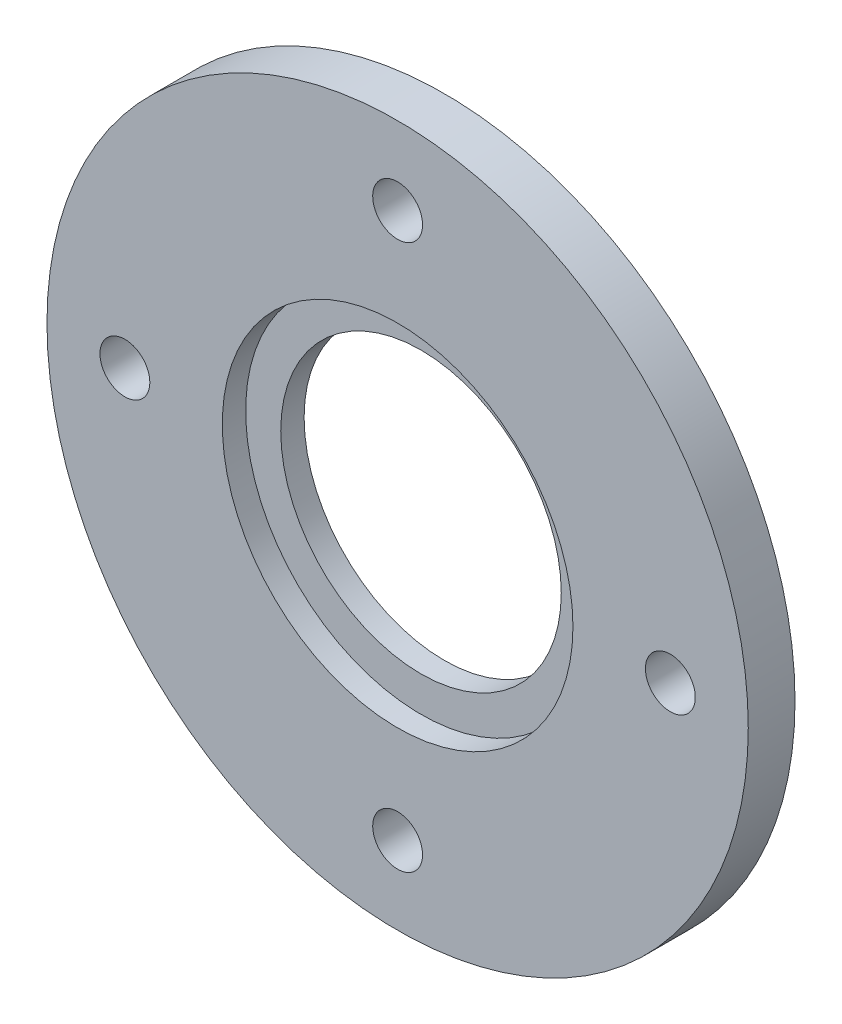
from build123d import *

# Parameters (mm, degrees)
SKETCH_1_R               = 22.5
SKETCH_1_R_2             = 9
EXTRUDE_1_DEPTH          = 3
SKETCH_2_R               = 1.6
CUT_EXTRUDE_1_DEPTH      = 32.960913629
PATTERN_CIRCULAR_2_COUNT = 4
CUT_EXTRUDE_START        = -1.5
SKETCH_3_R               = 11.25
SKETCH_3_R_2             = 9
CUT_EXTRUDE_2_DEPTH      = 1.5


with BuildPart() as part:
    # ｽｹｯﾁ1 → ﾎﾞｽ - 押し出し1 (new body)
    with BuildSketch(Plane.XY):
        Circle(SKETCH_1_R)
        Circle(SKETCH_1_R_2, mode=Mode.SUBTRACT)
    extrude(amount=EXTRUDE_1_DEPTH)

    # ｽｹｯﾁ2 → ｶｯﾄ - 押し出し1 (cut, through all)
    with BuildSketch(Plane.XY.offset(3)):
        with Locations((-17.5, 0)):
            Circle(SKETCH_2_R)
    cut_extrude_1 = extrude(amount=-CUT_EXTRUDE_1_DEPTH, mode=Mode.SUBTRACT)

    # 円形ﾊﾟﾀｰﾝ2: ｶｯﾄ - 押し出し1 ×4 about axis
    pattern_circular_2_axis = Axis((0, 0, 3), (0, 0, -1))
    for i in range(1, PATTERN_CIRCULAR_2_COUNT):
        add(cut_extrude_1.rotate(pattern_circular_2_axis, i * 360 / PATTERN_CIRCULAR_2_COUNT), mode=Mode.SUBTRACT)

    # ｽｹｯﾁ3 → ｶｯﾄ - 押し出し2 (cut)
    with BuildSketch(Plane.XY.offset(3).offset(CUT_EXTRUDE_START)):
        Circle(SKETCH_3_R)
        Circle(SKETCH_3_R_2, mode=Mode.SUBTRACT)
    extrude(amount=CUT_EXTRUDE_2_DEPTH, mode=Mode.SUBTRACT)


solid = part.part
